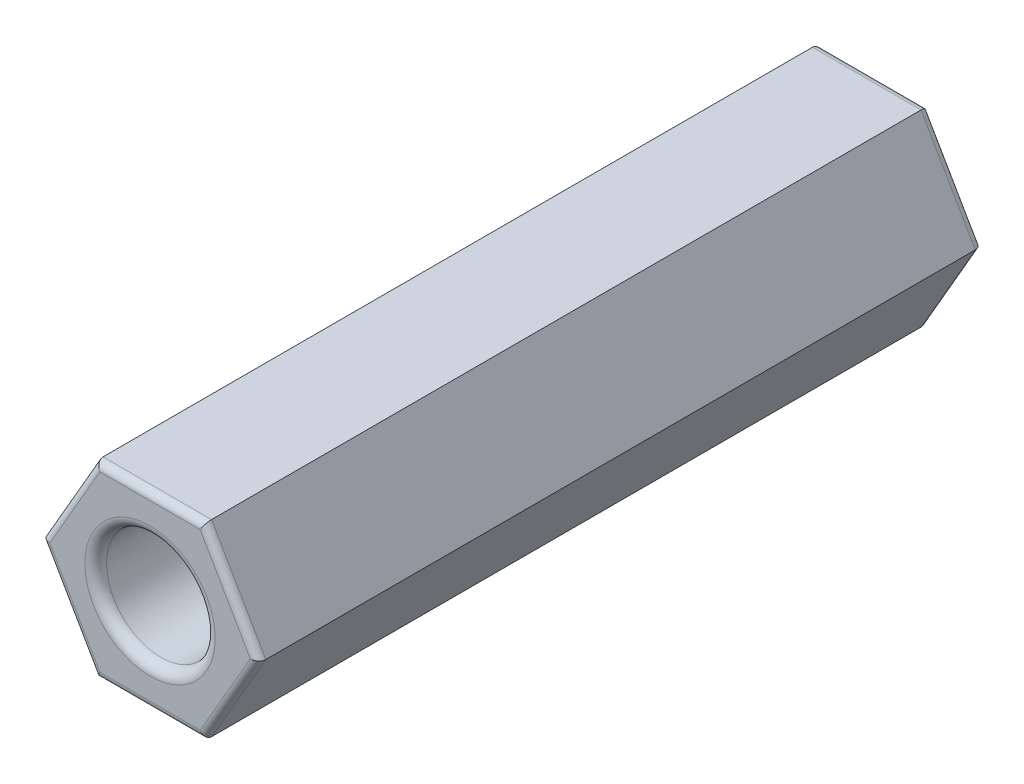
from build123d import *

# Parameters (mm, degrees)
SKETCH1_R           = 1.5
BOSS_EXTRUDE1_DEPTH = 20
FILLET1_R           = 0.3
FILLET2_R           = 0.2


with BuildPart() as part:
    # Sketch1 → Boss-Extrude1 (new body)
    with BuildSketch(Plane.XY):
        Polygon((3, 0), (1.5, 2.598076211), (-1.5, 2.598076211), (-3, 0), (-1.5, -2.598076211), (1.5, -2.598076211), align=None)
        Circle(SKETCH1_R, mode=Mode.SUBTRACT)
    extrude(amount=BOSS_EXTRUDE1_DEPTH)

    # Fillet1
    fillet1_edges = [part.edges().sort_by_distance(p)[0] for p in [
        (-1.5, 0, 0),
        (-1.5, 0, 20),
    ]]
    fillet(fillet1_edges, radius=FILLET1_R)

    # Fillet2
    fillet2_edges = [part.edges().sort_by_distance(p)[0] for p in [
        (-2.25, 1.299038106, 20),
        (-2.25, -1.299038106, 20),
        (0, -2.598076211, 20),
        (2.25, -1.299038106, 20),
        (2.25, 1.299038106, 20),
        (0, 2.598076211, 20),
        (2.25, -1.299038106, 0),
        (0, -2.598076211, 0),
        (-2.25, -1.299038106, 0),
        (-2.25, 1.299038106, 0),
        (0, 2.598076211, 0),
        (2.25, 1.299038106, 0),
    ]]
    fillet(fillet2_edges, radius=FILLET2_R)


solid = part.part
